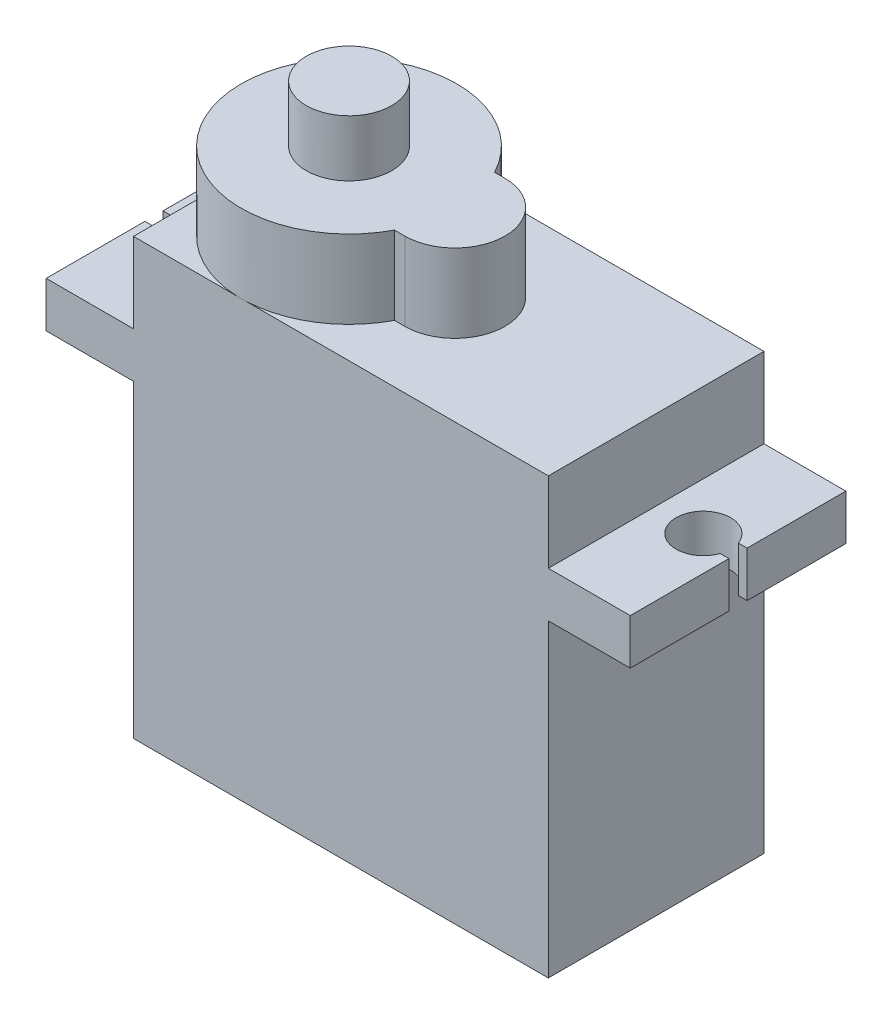
from build123d import *

# Parameters (mm, degrees)
BOSS_EXTRUDE1_DEPTH = 11.85
BOSS_EXTRUDE2_DEPTH = 4.3
SKETCH4_R           = 2.35
BOSS_EXTRUDE3_DEPTH = 31.3
CUT_EXTRUDE1_DEPTH  = 32.1


with BuildPart() as part:
    # Sketch1 → Boss-Extrude1 (new body)
    with BuildSketch(Plane.XY):
        Polygon((0, 0), (-6.125, 0), (-6.125, -4.4), (-10.925, -4.4), (-10.925, -6.9), (-6.125, -6.9), (-6.125, -23.9), (16.675, -23.9), (16.675, -6.9), (21.175, -6.9), (21.175, -4.4), (16.675, -4.4), (16.675, 0), align=None)
    extrude(amount=BOSS_EXTRUDE1_DEPTH)

    # Boss-Extrude2: read off the stored shape, not the designer's step
    # Boss-Extrude2 outline → Boss-Extrude2 (add)
    with BuildSketch(Plane(origin=(0, 0, 0), x_dir=(1, 0, 0), z_dir=(0, 1, 0))):
        with BuildLine():
            Line((5.048154438, -8.68), (5.62, -8.68))
            ThreePointArc((5.62, -8.68), (8.37, -5.93), (5.62, -3.18))
            Line((5.62, -3.18), (5.048154438, -3.18))
            ThreePointArc((5.048154438, -3.18), (-5.20541828, -2.759603678), (-0.44336187, -11.85))
            Line((-0.44336187, -11.85), (0.04336187, -11.85))
            ThreePointArc((0.04336187, -11.85), (2.970396322, -10.93541828), (5.048154438, -8.68))
        make_face()
    extrude(amount=BOSS_EXTRUDE2_DEPTH)

    # Sketch4 → Boss-Extrude3 (add)
    with BuildSketch(Plane.XZ.offset(23.9)):
        with Locations((-0.2, 5.93)):
            Circle(SKETCH4_R)
    extrude(amount=-BOSS_EXTRUDE3_DEPTH)

    # Sketch5 → Cut-Extrude1 (cut)
    with BuildSketch(Plane(origin=(0, -4.4, 0), x_dir=(1, 0, 0), z_dir=(0, 1, 0))):
        with BuildLine():
            Line((-10.137435839, -5.425), (-10.925, -5.425))
            Line((-10.925, -5.425), (-10.925, -5.925))
            Line((-10.925, -5.925), (-10.925, -6.425))
            Line((-10.925, -6.425), (-10.140971398, -6.425))
            ThreePointArc((-10.140971398, -6.425), (-7.225009375, -5.935303305), (-10.137435839, -5.425))
        make_face()
        with BuildLine():
            Line((20.687435839, -5.425), (21.475, -5.425))
            Line((21.475, -5.425), (21.475, -5.925))
            Line((21.475, -5.925), (21.475, -6.425))
            Line((21.475, -6.425), (20.690971398, -6.425))
            ThreePointArc((20.690971398, -6.425), (17.775009375, -5.935303305), (20.687435839, -5.425))
        make_face()
    extrude(amount=-CUT_EXTRUDE1_DEPTH, mode=Mode.SUBTRACT)


solid = part.part
